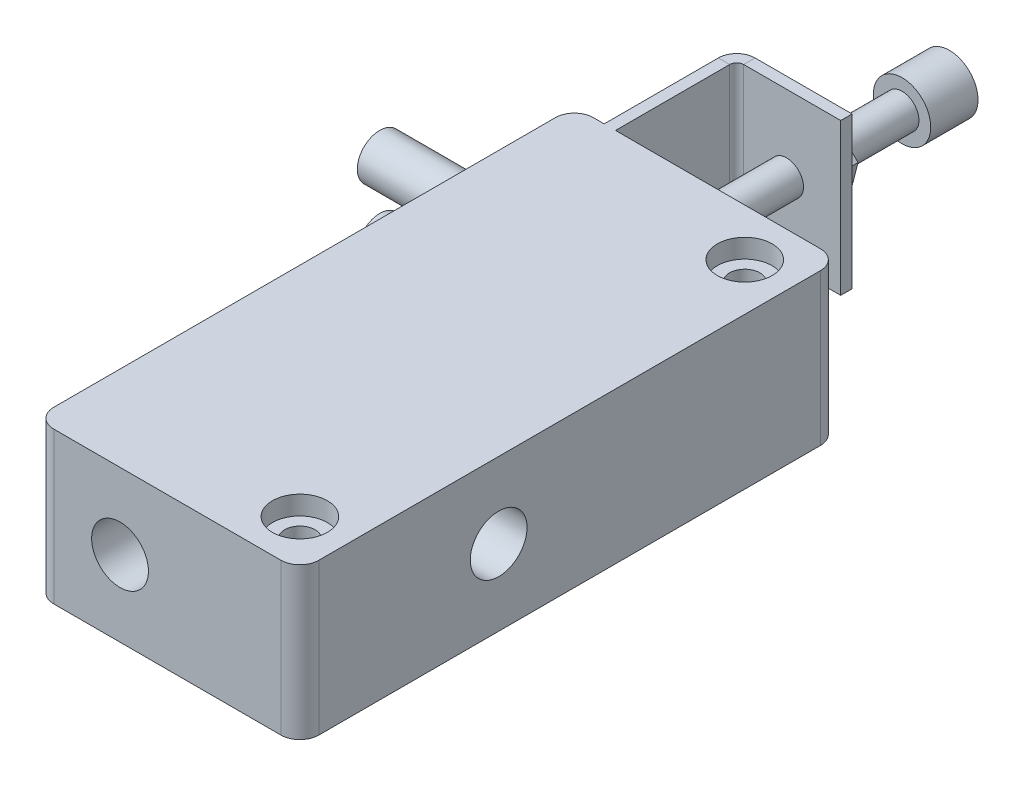
from build123d import *

# Parameters (mm, degrees)
CUT_EXTRUDE_START           = 11
CUT_EXTRUDE_1_OUTLINE_R     = 2.9
CUT_EXTRUDE_1_DEPTH         = 5
CUT_EXTRUDE_1_2_OUTLINE_R   = 2.9
CUT_EXTRUDE_1_2_DEPTH       = 4.9999999
CUT_EXTRUDE_START_2         = 2
CUT_EXTRUDE_1_3_OUTLINE_R   = 2.9
CUT_EXTRUDE_1_3_OUTLINE_R_2 = 1.6
CUT_EXTRUDE_1_3_DEPTH       = 12
CUT_EXTRUDE_START_3         = 4.9999999
CUT_EXTRUDE_1_4_OUTLINE_R   = 2.9
CUT_EXTRUDE_1_4_DEPTH       = 6.0000001
CUT_EXTRUDE_START_4         = 15.5
CUT_EXTRUDE_1_5_OUTLINE_R   = 5.75
CUT_EXTRUDE_1_5_OUTLINE_R_2 = 3
CUT_EXTRUDE_1_5_DEPTH       = 1.5
CUT_EXTRUDE_START_5         = 14
CUT_EXTRUDE_1_6_OUTLINE_R   = 4
CUT_EXTRUDE_1_6_OUTLINE_R_2 = 3
CUT_EXTRUDE_1_6_DEPTH       = 1.5
CUT_EXTRUDE_1_7_OUTLINE_R   = 3
CUT_EXTRUDE_1_7_DEPTH       = 14
CUT_EXTRUDE_START_6         = 14.5
CUT_EXTRUDE_1_8_OUTLINE_R   = 3
CUT_EXTRUDE_1_8_DEPTH       = 14
SKETCH_2_R                  = 6.172348418
CUT_EXTRUDE_2_DEPTH         = 3
SKETCH_3_R                  = 1.803021439
CUT_EXTRUDE_3_DEPTH         = 10
SM_BASE_FLANGE_1_DEPTH      = 16
SKETCH_7_R                  = 1.782386215
EXTRUDE_1_DEPTH             = 25
SKETCH_8_R                  = 3.028561668
EXTRUDE_2_DEPTH             = 5
CUT_EXTRUDE_4_DEPTH         = 4
EXTRUDE_3_DEPTH             = 3
SKETCH_11_R                 = 2.38049646
EXTRUDE_4_DEPTH             = 10


with BuildPart() as part:
    # 切除-拉伸1: read off the stored shape, not the designer's step
    # 切除-拉伸1 outline → 切除-拉伸1 (new body)
    with BuildSketch(Plane(origin=(0, 0, 0), x_dir=(1, 0, 0), z_dir=(0, 1, 0)).offset(CUT_EXTRUDE_START)):
        with BuildLine():
            ThreePointArc((-12, 28.5), (-13.414213562, 27.914213562), (-14, 26.5))
            Line((-14, 26.5), (-14, -26.5))
            ThreePointArc((-14, -26.5), (-13.414213562, -27.914213562), (-12, -28.5))
            Line((-12, -28.5), (12, -28.5))
            ThreePointArc((12, -28.5), (13.414213562, -27.914213562), (14, -26.5))
            Line((14, -26.5), (14, 26.5))
            ThreePointArc((14, 26.5), (13.414213562, 27.914213562), (12, 28.5))
            Line((12, 28.5), (-12, 28.5))
        make_face()
        with Locations((9, -23.5)):
            Circle(CUT_EXTRUDE_1_OUTLINE_R, mode=Mode.SUBTRACT)
        with Locations((9, 23.5)):
            Circle(CUT_EXTRUDE_1_OUTLINE_R, mode=Mode.SUBTRACT)
    extrude(amount=CUT_EXTRUDE_1_DEPTH)



with BuildPart() as body_2:
    # Cut-Extrude 1 2 outline → Cut-Extrude 1 2 (new body)
    with BuildSketch(Plane(origin=(0, 0, 0), x_dir=(1, 0, 0), z_dir=(0, 1, 0))):
        with BuildLine():
            ThreePointArc((-12, 28.5), (-13.414213562, 27.914213562), (-14, 26.5))
            Line((-14, 26.5), (-14, -26.5))
            ThreePointArc((-14, -26.5), (-13.414213562, -27.914213562), (-12, -28.5))
            Line((-12, -28.5), (12, -28.5))
            ThreePointArc((12, -28.5), (13.414213562, -27.914213562), (14, -26.5))
            Line((14, -26.5), (14, 26.5))
            ThreePointArc((14, 26.5), (13.414213562, 27.914213562), (12, 28.5))
            Line((12, 28.5), (-12, 28.5))
        make_face()
        with Locations((9, -23.5)):
            Circle(CUT_EXTRUDE_1_2_OUTLINE_R, mode=Mode.SUBTRACT)
        with Locations((9, 23.5)):
            Circle(CUT_EXTRUDE_1_2_OUTLINE_R, mode=Mode.SUBTRACT)
    extrude(amount=CUT_EXTRUDE_1_2_DEPTH)


with BuildPart() as part_1:
    add(part.part)

    add(body_2.part)  # Cut-Extrude 1 3 merges body 2
    # Cut-Extrude 1 3 outline → Cut-Extrude 1 3 (add)
    # profile 1 of 2: a face of its own
    with BuildSketch(Plane(origin=(0, 0, 0), x_dir=(1, 0, 0), z_dir=(0, 1, 0)).offset(CUT_EXTRUDE_START_2)):
        with Locations((9, 23.5)):
            Circle(CUT_EXTRUDE_1_3_OUTLINE_R)
        with Locations((9, 23.5)):
            Circle(CUT_EXTRUDE_1_3_OUTLINE_R_2, mode=Mode.SUBTRACT)
    # profile 2 of 2: a face of its own
    with BuildSketch(Plane(origin=(0, 0, 0), x_dir=(1, 0, 0), z_dir=(0, 1, 0)).offset(CUT_EXTRUDE_START_2)):
        with Locations((9, -23.5)):
            Circle(CUT_EXTRUDE_1_3_OUTLINE_R)
        with Locations((9, -23.5)):
            Circle(CUT_EXTRUDE_1_3_OUTLINE_R_2, mode=Mode.SUBTRACT)
    extrude(amount=CUT_EXTRUDE_1_3_DEPTH)

    # Cut-Extrude 1 4 outline → Cut-Extrude 1 4 (add)
    with BuildSketch(Plane(origin=(0, 0, 0), x_dir=(1, 0, 0), z_dir=(0, 1, 0)).offset(CUT_EXTRUDE_START_3)):
        with BuildLine():
            ThreePointArc((-12, 28.5), (-13.414213562, 27.914213562), (-14, 26.5))
            Line((-14, 26.5), (-14, -26.5))
            ThreePointArc((-14, -26.5), (-13.414213562, -27.914213562), (-12, -28.5))
            Line((-12, -28.5), (12, -28.5))
            ThreePointArc((12, -28.5), (13.414213562, -27.914213562), (14, -26.5))
            Line((14, -26.5), (14, 26.5))
            ThreePointArc((14, 26.5), (13.414213562, 27.914213562), (12, 28.5))
            Line((12, 28.5), (-12, 28.5))
        make_face()
        with Locations((9, -23.5)):
            Circle(CUT_EXTRUDE_1_4_OUTLINE_R, mode=Mode.SUBTRACT)
        with Locations((9, 23.5)):
            Circle(CUT_EXTRUDE_1_4_OUTLINE_R, mode=Mode.SUBTRACT)
    extrude(amount=CUT_EXTRUDE_1_4_DEPTH)



with BuildPart() as body_2_2:
    # Cut-Extrude 1 5 outline → Cut-Extrude 1 5 (new body)
    with BuildSketch(Plane.YZ.offset(CUT_EXTRUDE_START_4)):
        with Locations((8, 7.5)):
            Circle(CUT_EXTRUDE_1_5_OUTLINE_R)
        with Locations((8, 7.5)):
            Circle(CUT_EXTRUDE_1_5_OUTLINE_R_2, mode=Mode.SUBTRACT)
    extrude(amount=CUT_EXTRUDE_1_5_DEPTH)


with BuildPart() as part_2:
    add(part_1.part)

    add(body_2_2.part)  # Cut-Extrude 1 6 merges body 2 2
    # Cut-Extrude 1 6 outline → Cut-Extrude 1 6 (add)
    with BuildSketch(Plane.YZ.offset(CUT_EXTRUDE_START_5)):
        with Locations((8, 7.5)):
            Circle(CUT_EXTRUDE_1_6_OUTLINE_R)
        with Locations((8, 7.5)):
            Circle(CUT_EXTRUDE_1_6_OUTLINE_R_2, mode=Mode.SUBTRACT)
    extrude(amount=CUT_EXTRUDE_1_6_DEPTH)

    # Cut-Extrude 1 7 outline → Cut-Extrude 1 7 (cut)
    with BuildSketch(Plane.YZ):
        with Locations((8, 7.5)):
            Circle(CUT_EXTRUDE_1_7_OUTLINE_R)
    extrude(amount=CUT_EXTRUDE_1_7_DEPTH, mode=Mode.SUBTRACT)

    # Cut-Extrude 1 8 outline → Cut-Extrude 1 8 (cut)
    with BuildSketch(Plane.XY.offset(CUT_EXTRUDE_START_6)):
        with Locations((-5, 8)):
            Circle(CUT_EXTRUDE_1_8_OUTLINE_R)
    extrude(amount=CUT_EXTRUDE_1_8_DEPTH, mode=Mode.SUBTRACT)

    # 草图2 → 切除-拉伸2 (cut)
    with BuildSketch(Plane(origin=(17, 0, 0), x_dir=(0, 0, -1), z_dir=(1, 0, 0))):
        with Locations((-7.5, 8)):
            Circle(SKETCH_2_R)
    extrude(amount=-CUT_EXTRUDE_2_DEPTH, mode=Mode.SUBTRACT)

    # 草图3 → 切除-拉伸3 (cut)
    with BuildSketch(Plane(origin=(0, 0, -28.5), x_dir=(-1, 0, 0), z_dir=(0, 0, -1))):
        with Locations((-7.733778242, 7.980270974)):
            Circle(SKETCH_3_R)
    extrude(amount=-CUT_EXTRUDE_3_DEPTH, mode=Mode.SUBTRACT)



with BuildPart() as body_2_3:
    # 基体-法兰1: sheet metal written as solids
    # 草图4 → 基体-法兰1 (new body)
    with BuildSketch(Plane(origin=(0, 0, 0), x_dir=(1, 0, 0), z_dir=(0, 1, 0))):
        with BuildLine():
            Line((-10.853055632, 28.5), (-10.853055632, 40.567762067))
            ThreePointArc((-10.853055632, 40.567762067), (-10.285838624, 41.937145059), (-8.916455632, 42.504362067))
            Line((-8.916455632, 42.504362067), (1.33725023, 42.504362067))
            Line((1.33725023, 42.504362067), (1.33725023, 41.304362067))
            Line((1.33725023, 41.304362067), (-8.916455632, 41.304362067))
            ThreePointArc((-8.916455632, 41.304362067), (-9.437310487, 41.088616922), (-9.653055632, 40.567762067))
            Line((-9.653055632, 40.567762067), (-9.653055632, 28.5))
            Line((-9.653055632, 28.5), (-10.853055632, 28.5))
        make_face()
    extrude(amount=SM_BASE_FLANGE_1_DEPTH)


with BuildPart() as part_3:
    add(part_2.part)

    add(body_2_3.part)  # 凸台-拉伸1 merges body 2 3
    # 草图7 → 凸台-拉伸1 (add)
    with BuildSketch(Plane(origin=(0, 0, -28.5), x_dir=(-1, 0, 0), z_dir=(0, 0, -1))):
        with Locations((4.3798438, 7.940812922)):
            Circle(SKETCH_7_R)
    extrude(amount=EXTRUDE_1_DEPTH)

    # 草图8 → 凸台-拉伸2 (add)
    with BuildSketch(Plane(origin=(0, 0, -53.5), x_dir=(-1, 0, 0), z_dir=(0, 0, -1))):
        with Locations((4.3798438, 7.940812922)):
            Circle(SKETCH_8_R)
    extrude(amount=EXTRUDE_2_DEPTH)

    # 草图9 → 切除-拉伸4 (cut)
    with BuildSketch(Plane(origin=(0, 0, -58.5), x_dir=(-1, 0, 0), z_dir=(0, 0, -1))):
        Polygon((3.093792683, 8.769117031), (3.01948584, 7.241212038), (4.305536958, 6.412907929), (5.665894918, 7.112508812), (5.74020176, 8.640413805), (4.454150642, 9.468717915), align=None)
    extrude(amount=-CUT_EXTRUDE_4_DEPTH, mode=Mode.SUBTRACT)

    # 草图10 → 凸台-拉伸3 (add)
    with BuildSketch(Plane(origin=(0, 0, -42.504362067), x_dir=(-1, 0, 0), z_dir=(0, 0, -1))):
        Polygon((7.727133917, 7.012317312), (6.857589643, 10.375403392), (3.510299527, 11.303899001), (1.032553683, 8.869308531), (1.902097957, 5.506222451), (5.249388073, 4.577726842), align=None)
    extrude(amount=EXTRUDE_3_DEPTH)

    # 草图11 → 凸台-拉伸4 (add)
    with BuildSketch(Plane.ZY.offset(14)):
        with Locations((-17.942443325, 11.739355059)):
            Circle(SKETCH_11_R)
        with Locations((-17.942443325, 4.138043136)):
            Circle(SKETCH_11_R)
    extrude(amount=EXTRUDE_4_DEPTH)


solid = part_3.part
